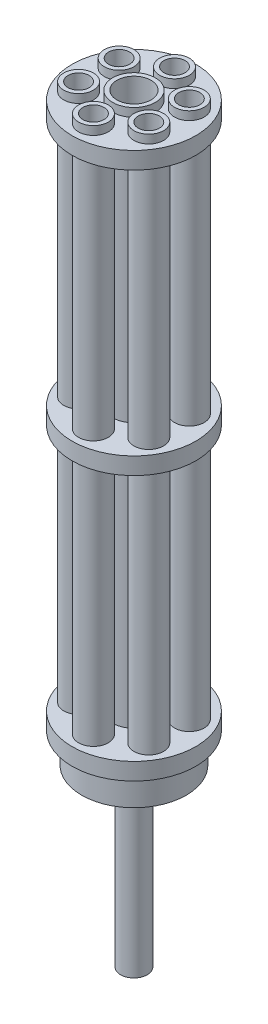
from build123d import *

# Parameters (mm, degrees)
SKETCH1_R                = 14.5
BOSS_EXTRUDE1_DEPTH      = 4
BOSS_EXTRUDE2_DEPTH      = 2
BOSS_EXTRUDE2_DEPTH_BACK = 125
SKETCH2_R                = 5
SKETCH2_R_2              = 4
SKETCH2_R_3              = 3.479997652
SKETCH2_R_4              = 2.479997652
LPATTERN4_START          = -124
LPATTERN4_OUTLINE_R      = 14.5
LPATTERN4_DEPTH          = 4
LPATTERN4_START_2        = -62
LPATTERN4_2_OUTLINE_R    = 14.5
LPATTERN4_2_OUTLINE_R_2  = 3.479997652
LPATTERN4_2_OUTLINE_R_3  = 5
LPATTERN4_2_OUTLINE_R_4  = 4
LPATTERN4_2_OUTLINE_R_5  = 2.479997652
LPATTERN4_2_DEPTH        = 4
SKETCH8_R                = 2.479997652
CUT_EXTRUDE4_DEPTH       = 128
SKETCH12_R               = 3.125
BOSS_EXTRUDE4_DEPTH      = 48
CUT_EXTRUDE5_DEPTH       = 48
SKETCH14_R               = 4
CUT_EXTRUDE6_DEPTH       = 124
SKETCH16_R               = 12.25
SKETCH16_R_2             = 2.479997652
BOSS_EXTRUDE5_DEPTH      = 7


# Read off the part's stored shape, not the designer's step: LPattern4
with BuildPart() as part:
    # Sketch1 → Boss-Extrude1 (new body)
    with BuildSketch(Plane(origin=(0, 0, 0), x_dir=(1, 0, 0), z_dir=(0, 1, 0))):
        with Locations(Location((0, 0, 0), (0, 0, 270))):
            Circle(SKETCH1_R)
    extrude(amount=BOSS_EXTRUDE1_DEPTH)

    # Sketch2 → Boss-Extrude2 (add, two sides: drawn at the far end of the back side and taken through both)
    # profile 1 of 7: a face of its own
    with BuildSketch(Plane(origin=(0, 4, 0), x_dir=(1, 0, 0), z_dir=(0, 1, 0)).offset(-BOSS_EXTRUDE2_DEPTH_BACK)):
        with Locations(Location((0, 0, 0), (0, 0, 270))):
            Circle(SKETCH2_R)
        with Locations(Location((0, 0, 0), (0, 0, 270))):
            Circle(SKETCH2_R_2, mode=Mode.SUBTRACT)
    # profile 2 of 7: a face of its own
    with BuildSketch(Plane(origin=(0, 4, 0), x_dir=(1, 0, 0), z_dir=(0, 1, 0)).offset(-BOSS_EXTRUDE2_DEPTH_BACK)):
        with Locations(Location((0, 9.5, 0), (0, 0, 270))):
            Circle(SKETCH2_R_3)
        with Locations(Location((0, 9.5, 0), (0, 0, 270))):
            Circle(SKETCH2_R_4, mode=Mode.SUBTRACT)
    # profile 3 of 7: a face of its own
    with BuildSketch(Plane(origin=(0, 4, 0), x_dir=(1, 0, 0), z_dir=(0, 1, 0)).offset(-BOSS_EXTRUDE2_DEPTH_BACK)):
        with Locations(Location((8.227241336, 4.75, 0), (0, 0, 270))):
            Circle(SKETCH2_R_3)
        with Locations(Location((8.227241336, 4.75, 0), (0, 0, 270))):
            Circle(SKETCH2_R_4, mode=Mode.SUBTRACT)
    # profile 4 of 7: a face of its own
    with BuildSketch(Plane(origin=(0, 4, 0), x_dir=(1, 0, 0), z_dir=(0, 1, 0)).offset(-BOSS_EXTRUDE2_DEPTH_BACK)):
        with Locations(Location((8.227241336, -4.75, 0), (0, 0, 270))):
            Circle(SKETCH2_R_3)
        with Locations(Location((8.227241336, -4.75, 0), (0, 0, 270))):
            Circle(SKETCH2_R_4, mode=Mode.SUBTRACT)
    # profile 5 of 7: a face of its own
    with BuildSketch(Plane(origin=(0, 4, 0), x_dir=(1, 0, 0), z_dir=(0, 1, 0)).offset(-BOSS_EXTRUDE2_DEPTH_BACK)):
        with Locations(Location((0, -9.5, 0), (0, 0, 270))):
            Circle(SKETCH2_R_3)
        with Locations(Location((0, -9.5, 0), (0, 0, 270))):
            Circle(SKETCH2_R_4, mode=Mode.SUBTRACT)
    # profile 6 of 7: a face of its own
    with BuildSketch(Plane(origin=(0, 4, 0), x_dir=(1, 0, 0), z_dir=(0, 1, 0)).offset(-BOSS_EXTRUDE2_DEPTH_BACK)):
        with Locations(Location((-8.227241336, -4.75, 0), (0, 0, 270))):
            Circle(SKETCH2_R_3)
        with Locations(Location((-8.227241336, -4.75, 0), (0, 0, 270))):
            Circle(SKETCH2_R_4, mode=Mode.SUBTRACT)
    # profile 7 of 7: a face of its own
    with BuildSketch(Plane(origin=(0, 4, 0), x_dir=(1, 0, 0), z_dir=(0, 1, 0)).offset(-BOSS_EXTRUDE2_DEPTH_BACK)):
        with Locations(Location((-8.227241336, 4.75, 0), (0, 0, 270))):
            Circle(SKETCH2_R_3)
        with Locations(Location((-8.227241336, 4.75, 0), (0, 0, 270))):
            Circle(SKETCH2_R_4, mode=Mode.SUBTRACT)
    extrude(amount=BOSS_EXTRUDE2_DEPTH + BOSS_EXTRUDE2_DEPTH_BACK)

    # LPattern4 outline → LPattern4 (add)
    with BuildSketch(Plane(origin=(0, 0, 0), x_dir=(1, 0, 0), z_dir=(0, 1, 0)).offset(LPATTERN4_START)):
        Circle(LPATTERN4_OUTLINE_R)
    extrude(amount=LPATTERN4_DEPTH)

    # LPattern4 2 outline → LPattern4 2 (add)
    # profile 1 of 8: a face of its own
    with BuildSketch(Plane(origin=(0, 0, 0), x_dir=(1, 0, 0), z_dir=(0, 1, 0)).offset(LPATTERN4_START_2)):
        Circle(LPATTERN4_2_OUTLINE_R)
        with Locations((-8.227241336, -4.75)):
            Circle(LPATTERN4_2_OUTLINE_R_2, mode=Mode.SUBTRACT)
        with Locations((0, -9.5)):
            Circle(LPATTERN4_2_OUTLINE_R_2, mode=Mode.SUBTRACT)
        with Locations((8.227241336, -4.75)):
            Circle(LPATTERN4_2_OUTLINE_R_2, mode=Mode.SUBTRACT)
        with Locations((-8.227241336, 4.75)):
            Circle(LPATTERN4_2_OUTLINE_R_2, mode=Mode.SUBTRACT)
        Circle(LPATTERN4_2_OUTLINE_R_3, mode=Mode.SUBTRACT)
        with Locations((8.227241336, 4.75)):
            Circle(LPATTERN4_2_OUTLINE_R_2, mode=Mode.SUBTRACT)
        with Locations((0, 9.5)):
            Circle(LPATTERN4_2_OUTLINE_R_2, mode=Mode.SUBTRACT)
    # profile 2 of 8: a face of its own
    with BuildSketch(Plane(origin=(0, 0, 0), x_dir=(1, 0, 0), z_dir=(0, 1, 0)).offset(LPATTERN4_START_2)):
        Circle(LPATTERN4_2_OUTLINE_R_4)
    # profile 3 of 8: a face of its own
    with BuildSketch(Plane(origin=(0, 0, 0), x_dir=(1, 0, 0), z_dir=(0, 1, 0)).offset(LPATTERN4_START_2)):
        with Locations((0, 9.5)):
            Circle(LPATTERN4_2_OUTLINE_R_5)
    # profile 4 of 8: a face of its own
    with BuildSketch(Plane(origin=(0, 0, 0), x_dir=(1, 0, 0), z_dir=(0, 1, 0)).offset(LPATTERN4_START_2)):
        with Locations((8.227241336, 4.75)):
            Circle(LPATTERN4_2_OUTLINE_R_5)
    # profile 5 of 8: a face of its own
    with BuildSketch(Plane(origin=(0, 0, 0), x_dir=(1, 0, 0), z_dir=(0, 1, 0)).offset(LPATTERN4_START_2)):
        with Locations((8.227241336, -4.75)):
            Circle(LPATTERN4_2_OUTLINE_R_5)
    # profile 6 of 8: a face of its own
    with BuildSketch(Plane(origin=(0, 0, 0), x_dir=(1, 0, 0), z_dir=(0, 1, 0)).offset(LPATTERN4_START_2)):
        with Locations((0, -9.5)):
            Circle(LPATTERN4_2_OUTLINE_R_5)
    # profile 7 of 8: a face of its own
    with BuildSketch(Plane(origin=(0, 0, 0), x_dir=(1, 0, 0), z_dir=(0, 1, 0)).offset(LPATTERN4_START_2)):
        with Locations((-8.227241336, -4.75)):
            Circle(LPATTERN4_2_OUTLINE_R_5)
    # profile 8 of 8: a face of its own
    with BuildSketch(Plane(origin=(0, 0, 0), x_dir=(1, 0, 0), z_dir=(0, 1, 0)).offset(LPATTERN4_START_2)):
        with Locations((-8.227241336, 4.75)):
            Circle(LPATTERN4_2_OUTLINE_R_5)
    extrude(amount=LPATTERN4_2_DEPTH)

    # Sketch8 → Cut-Extrude4 (cut)
    with BuildSketch(Plane(origin=(0, 4, 0), x_dir=(1, 0, 0), z_dir=(0, 1, 0))):
        with Locations(Location((-8.227241336, -4.75, 0), (0, 0, 270))):
            Circle(SKETCH8_R)
        with Locations(Location((0, -9.5, 0), (0, 0, 270))):
            Circle(SKETCH8_R)
        with Locations(Location((8.227241336, -4.75, 0), (0, 0, 270))):
            Circle(SKETCH8_R)
        with Locations(Location((8.227241336, 4.75, 0), (0, 0, 270))):
            Circle(SKETCH8_R)
        with Locations(Location((0, 9.5, 0), (0, 0, 270))):
            Circle(SKETCH8_R)
        with Locations(Location((-8.227241336, 4.75, 0), (0, 0, 270))):
            Circle(SKETCH8_R)
    extrude(amount=-CUT_EXTRUDE4_DEPTH, mode=Mode.SUBTRACT)

    # Sketch12 → Boss-Extrude4 (add)
    with BuildSketch(Plane.XZ.offset(124)):
        with Locations(Location((0, 0, 0), (0, 0, 90))):
            Circle(SKETCH12_R)
    extrude(amount=BOSS_EXTRUDE4_DEPTH)

    # Sketch9 → Cut-Extrude5 (cut)
    with BuildSketch(Plane.XZ.offset(172)):
        with BuildLine():
            Line((1.55, 1.489966443), (1.55, -1.489966443))
            ThreePointArc((1.55, -1.489966443), (-2.15, 0), (1.55, 1.489966443))
        make_face()
    extrude(amount=-CUT_EXTRUDE5_DEPTH, mode=Mode.SUBTRACT)

    # Sketch14 → Cut-Extrude6 (cut)
    with BuildSketch(Plane(origin=(0, 4, 0), x_dir=(1, 0, 0), z_dir=(0, 1, 0))):
        with Locations(Location((0, 0, 0), (0, 0, 270))):
            Circle(SKETCH14_R)
    extrude(amount=-CUT_EXTRUDE6_DEPTH, mode=Mode.SUBTRACT)

    # Sketch16 → Boss-Extrude5 (add)
    with BuildSketch(Plane.XZ.offset(124)):
        with Locations(Location((0, 0, 0), (0, 0, 90))):
            Circle(SKETCH16_R)
        with Locations(Location((0, 9.5, 0), (0, 0, 90))):
            Circle(SKETCH16_R_2, mode=Mode.SUBTRACT)
        with Locations(Location((8.227241336, 4.75, 0), (0, 0, 90))):
            Circle(SKETCH16_R_2, mode=Mode.SUBTRACT)
        with Locations(Location((8.227241336, -4.75, 0), (0, 0, 90))):
            Circle(SKETCH16_R_2, mode=Mode.SUBTRACT)
        with Locations(Location((0, -9.5, 0), (0, 0, 90))):
            Circle(SKETCH16_R_2, mode=Mode.SUBTRACT)
        with Locations(Location((-8.227241336, -4.75, 0), (0, 0, 90))):
            Circle(SKETCH16_R_2, mode=Mode.SUBTRACT)
        with Locations(Location((-8.227241336, 4.75, 0), (0, 0, 90))):
            Circle(SKETCH16_R_2, mode=Mode.SUBTRACT)
    extrude(amount=BOSS_EXTRUDE5_DEPTH)


solid = part.part
